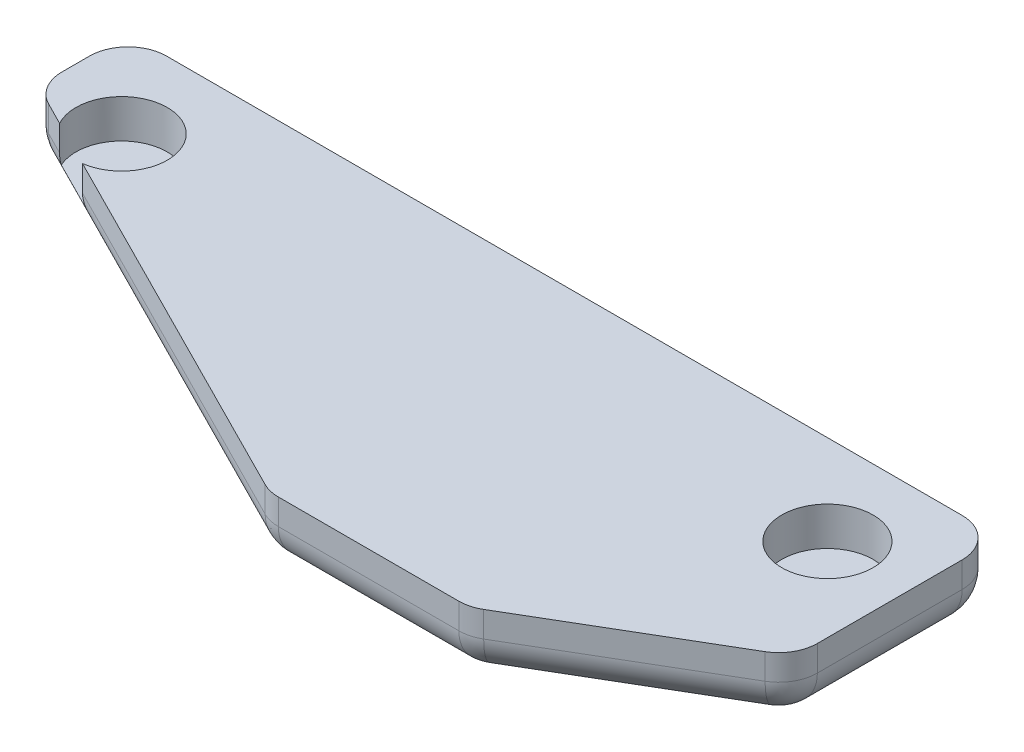
from build123d import *

# Parameters (mm, degrees)
BOSS_EXTRUDE1_DEPTH = 2.5
SKETCH4_R           = 1.78
CUT_EXTRUDE1_DEPTH  = 1.5
FILLET1_R           = 1.5


with BuildPart() as part:
    # Sketch2 → Boss-Extrude1 (new body)
    with BuildSketch(Plane(origin=(0, 0, 0), x_dir=(1, 0, 0), z_dir=(0, 1, 0))):
        Polygon((-21.216153836, 11.741903429), (-21.216153836, 8.241903429), (-3.016153836, -0.958096571), (4.783846164, -0.958096571), (12.783846164, 3.741903429), (12.783846164, 11.741903429), align=None)
    extrude(amount=BOSS_EXTRUDE1_DEPTH)

    # Sketch4 → Cut-Extrude1 (cut)
    with BuildSketch(Plane(origin=(0, 2.5, 0), x_dir=(1, 0, 0), z_dir=(0, 1, 0))):
        with Locations((-17.966153836, 8.241903429)):
            Circle(SKETCH4_R)
        with Locations(Location((9.533846164, 8.241903429, 0), (0, 0, 90))):
            Circle(SKETCH4_R)
    extrude(amount=-CUT_EXTRUDE1_DEPTH, mode=Mode.SUBTRACT)

    # Fillet1
    # the kernel refuses this fillet: 1.5 mm, written as the material it takes off along each edge
    with BuildSketch(Plane(origin=(4.375823919, 1.5, -0.541903429), x_dir=(0.5065490486308655, 0, 0.8622111466057285), z_dir=(0, -1, 0))) as fillet1_piece_1_section:
        Polygon((0, 0), (FILLET1_R, 0), (FILLET1_R, FILLET1_R * 0.272014830087), (FILLET1_R * 0.862211146606, FILLET1_R * 0.506549048631), align=None)
    fillet1_piece_1 = extrude(amount=FILLET1_R, mode=Mode.PRIVATE)
    fillet1_piece_1 = fillet1_piece_1 - Plane(origin=(4.375823919, 1.5, -0.541903429), x_dir=(-0.2624774784569825, 0, -0.964938118898235), z_dir=(0, -1, 0)) * Sphere(FILLET1_R, mode=Mode.PRIVATE)
    add(fillet1_piece_1, mode=Mode.SUBTRACT)
    with BuildSketch(Plane(origin=(-2.658577298, 1.5, -0.541903429), x_dir=(-0.4511321826525704, 0, 0.8924571439431296), z_dir=(0, -1, 0))) as fillet1_piece_2_section:
        Polygon((0, 0), (FILLET1_R, 0), (FILLET1_R, -FILLET1_R * 0.238384358714), (FILLET1_R * 0.892457143943, -FILLET1_R * 0.451132182653), align=None)
    fillet1_piece_2 = extrude(amount=FILLET1_R, mode=Mode.PRIVATE)
    fillet1_piece_2 = fillet1_piece_2 - Plane(origin=(-2.658577298, 1.5, -0.541903429), x_dir=(0.23188667065710186, 0, -0.972742808748317), z_dir=(0, -1, 0)) * Sphere(FILLET1_R, mode=Mode.PRIVATE)
    add(fillet1_piece_2, mode=Mode.SUBTRACT)
    with BuildSketch(Plane(origin=(-19.716153836, 1.5, -10.241903429), x_dir=(0, -1, 0), z_dir=(-1, 0, 0))) as fillet1_piece_3_section:
        Polygon((0, 0), (FILLET1_R, 0), (FILLET1_R, -FILLET1_R), (0, -FILLET1_R), align=None)
    fillet1_piece_3 = extrude(amount=FILLET1_R, mode=Mode.PRIVATE)
    fillet1_piece_3 = fillet1_piece_3 - Plane(origin=(-19.716153836, 1.5, -10.241903429), x_dir=(0, 0.7071067811865475, 0.7071067811865475), z_dir=(-1, 0, 0)) * Sphere(FILLET1_R, mode=Mode.PRIVATE)
    add(fillet1_piece_3, mode=Mode.SUBTRACT)
    with BuildSketch(Plane(origin=(-19.716153836, 1.5, -9.164414646), x_dir=(-0.4511321826525704, 0, 0.8924571439431296), z_dir=(0, -1, 0))) as fillet1_piece_4_section:
        Polygon((0, 0), (FILLET1_R, 0), (FILLET1_R, FILLET1_R * 0.615007478031), (FILLET1_R * 0.451132182653, FILLET1_R * 0.892457143943), align=None)
    fillet1_piece_4 = extrude(amount=FILLET1_R, mode=Mode.PRIVATE)
    fillet1_piece_4 = fillet1_piece_4 - Plane(origin=(-19.716153836, 1.5, -9.164414646), x_dir=(0.8518016737047921, 0, -0.5238643991279756), z_dir=(0, -1, 0)) * Sphere(FILLET1_R, mode=Mode.PRIVATE)
    add(fillet1_piece_4, mode=Mode.SUBTRACT)
    with BuildSketch(Plane(origin=(11.283846164, 1.5, -4.600366498), x_dir=(1, 0, 0), z_dir=(0, -1, 0))) as fillet1_piece_5_section:
        Polygon((0, 0), (FILLET1_R, 0), (FILLET1_R, FILLET1_R * 0.572308712676), (FILLET1_R * 0.506549048631, FILLET1_R * 0.862211146606), align=None)
    fillet1_piece_5 = extrude(amount=FILLET1_R, mode=Mode.PRIVATE)
    fillet1_piece_5 = fillet1_piece_5 - Plane(origin=(11.283846164, 1.5, -4.600366498), x_dir=(-0.8679138922240112, 0, -0.49671468237265487), z_dir=(0, -1, 0)) * Sphere(FILLET1_R, mode=Mode.PRIVATE)
    add(fillet1_piece_5, mode=Mode.SUBTRACT)
    with BuildSketch(Plane(origin=(11.283846164, 1.5, -10.241903429), x_dir=(0, 0, -1), z_dir=(0, -1, 0))) as fillet1_piece_6_section:
        Polygon((0, 0), (FILLET1_R, 0), (FILLET1_R, FILLET1_R), (0, FILLET1_R), align=None)
    fillet1_piece_6 = extrude(amount=FILLET1_R, mode=Mode.PRIVATE)
    fillet1_piece_6 = fillet1_piece_6 - Plane(origin=(11.283846164, 1.5, -10.241903429), x_dir=(-0.7071067811865477, 0, 0.7071067811865474), z_dir=(0, -1, 0)) * Sphere(FILLET1_R, mode=Mode.PRIVATE)
    add(fillet1_piece_6, mode=Mode.SUBTRACT)
    with BuildSketch(Plane(origin=(4.783846164, 1.5, 0.958096571), x_dir=(0.8622111466057288, 0, -0.506549048630865), z_dir=(0, 1, 0))) as fillet1_piece_7:
        with BuildLine():
            CenterArc((FILLET1_R * 0.272014830087, FILLET1_R), FILLET1_R, 239.565764247, 30.434235753)
            Line((-FILLET1_R * 0.234534218543, FILLET1_R * 0.137788853394), (0, 0))
            Line((0, 0), (FILLET1_R * 0.272014830087, 0))
        make_face()
    extrude(amount=2.020055613, mode=Mode.SUBTRACT)
    with BuildSketch(Plane(origin=(-3.016153836, 1.5, 0.958096571), x_dir=(1, 0, 0), z_dir=(0, 1, 0))) as fillet1_piece_8:
        with BuildLine():
            CenterArc((FILLET1_R * 0.238384358714, FILLET1_R), FILLET1_R, 243.183653156, 26.816346844)
            Line((-FILLET1_R * 0.212747823939, FILLET1_R * 0.107542856057), (0, 0))
            Line((0, 0), (FILLET1_R * 0.238384358714, 0))
        make_face()
    extrude(amount=1.893941345, mode=Mode.SUBTRACT)
    with BuildSketch(Plane(origin=(-21.216153836, 0, -10.241903429), x_dir=(0, 1, 0), z_dir=(0, 0, 1))) as fillet1_piece_9:
        with BuildLine():
            CenterArc((FILLET1_R, -FILLET1_R), FILLET1_R, 90, 90)
            Line((0, -FILLET1_R), (0, 0))
            Line((0, 0), (FILLET1_R, 0))
        make_face()
    extrude(amount=1.077488783, mode=Mode.SUBTRACT)
    with BuildSketch(Plane(origin=(-20.39285211, 0, -7.825728931), x_dir=(0.4511321826525704, 0, -0.8924571439431296), z_dir=(0.8924571439431296, 0, 0.4511321826525704))) as fillet1_piece_10:
        with BuildLine():
            CenterArc((FILLET1_R, FILLET1_R), FILLET1_R, 180, 90)
            Line((0, FILLET1_R), (0, 0))
            Line((0, 0), (FILLET1_R, 0))
        make_face()
    extrude(amount=19.113048345, mode=Mode.SUBTRACT)
    with BuildSketch(Plane(origin=(-2.658577298, 0, 0.958096571), x_dir=(0, 1, 0), z_dir=(1, 0, 0))) as fillet1_piece_11:
        with BuildLine():
            CenterArc((FILLET1_R, -FILLET1_R), FILLET1_R, 90, 90)
            Line((0, -FILLET1_R), (0, 0))
            Line((0, 0), (FILLET1_R, 0))
        make_face()
    extrude(amount=7.034401217, mode=Mode.SUBTRACT)
    with BuildSketch(Plane(origin=(5.135647492, 0, 0.751413291), x_dir=(0, 1, 0), z_dir=(0.8622111466057285, 0, -0.5065490486308655))) as fillet1_piece_12:
        with BuildLine():
            CenterArc((FILLET1_R, -FILLET1_R), FILLET1_R, 90, 90)
            Line((0, -FILLET1_R), (0, 0))
            Line((0, 0), (FILLET1_R, 0))
        make_face()
    extrude(amount=8.011984387, mode=Mode.SUBTRACT)
    with BuildSketch(Plane(origin=(12.783846164, 1.5, -3.741903429), x_dir=(0, 0, -1), z_dir=(0, 1, 0))) as fillet1_piece_13:
        with BuildLine():
            CenterArc((FILLET1_R * 0.572308712676, FILLET1_R), FILLET1_R, 210.434235753, 59.565764247)
            Line((-FILLET1_R * 0.289902433929, FILLET1_R * 0.493450951369), (0, 0))
            Line((0, 0), (FILLET1_R * 0.572308712676, 0))
        make_face()
    extrude(amount=3.146157673, mode=Mode.SUBTRACT)
    with BuildSketch(Plane(origin=(12.783846164, 0, -4.600366498), x_dir=(0, 1, 0), z_dir=(0, 0, -1))) as fillet1_piece_14:
        with BuildLine():
            CenterArc((FILLET1_R, -FILLET1_R), FILLET1_R, 90, 90)
            Line((0, -FILLET1_R), (0, 0))
            Line((0, 0), (FILLET1_R, 0))
        make_face()
    extrude(amount=5.641536931, mode=Mode.SUBTRACT)
    with BuildSketch(Plane(origin=(11.283846164, 0, -11.741903429), x_dir=(0, 0, 1), z_dir=(-1, 0, 0))) as fillet1_piece_15:
        with BuildLine():
            CenterArc((FILLET1_R, FILLET1_R), FILLET1_R, 180, 90)
            Line((0, FILLET1_R), (0, 0))
            Line((0, 0), (FILLET1_R, 0))
        make_face()
    extrude(amount=31, mode=Mode.SUBTRACT)
    with BuildSketch(Plane(origin=(12.783846164, 1.5, -11.741903429), x_dir=(0, 0, 1), z_dir=(0, 1, 0))) as fillet1_piece_16:
        with BuildLine():
            CenterArc((FILLET1_R, -FILLET1_R), FILLET1_R, 90, 90)
            Line((0, -FILLET1_R), (0, 0))
            Line((0, 0), (FILLET1_R, 0))
        make_face()
    extrude(amount=4.75, mode=Mode.SUBTRACT)
    with BuildSketch(Plane(origin=(-21.216153836, 1.5, -8.241903429), x_dir=(0, 0, -1), z_dir=(0, 1, 0))) as fillet1_piece_17:
        with BuildLine():
            CenterArc((FILLET1_R * 0.615007478031, -FILLET1_R), FILLET1_R, 90, 63.183653156)
            Line((-FILLET1_R * 0.277449665912, -FILLET1_R * 0.548867817347), (0, 0))
            Line((0, 0), (FILLET1_R * 0.615007478031, 0))
        make_face()
    extrude(amount=3.306278043, mode=Mode.SUBTRACT)
    with BuildSketch(Plane(origin=(-21.216153836, 1.5, -11.741903429), x_dir=(0, 0, 1), z_dir=(0, 1, 0))) as fillet1_piece_18:
        with BuildLine():
            CenterArc((FILLET1_R, FILLET1_R), FILLET1_R, 180, 90)
            Line((0, FILLET1_R), (0, 0))
            Line((0, 0), (FILLET1_R, 0))
        make_face()
    extrude(amount=4.75, mode=Mode.SUBTRACT)


solid = part.part
